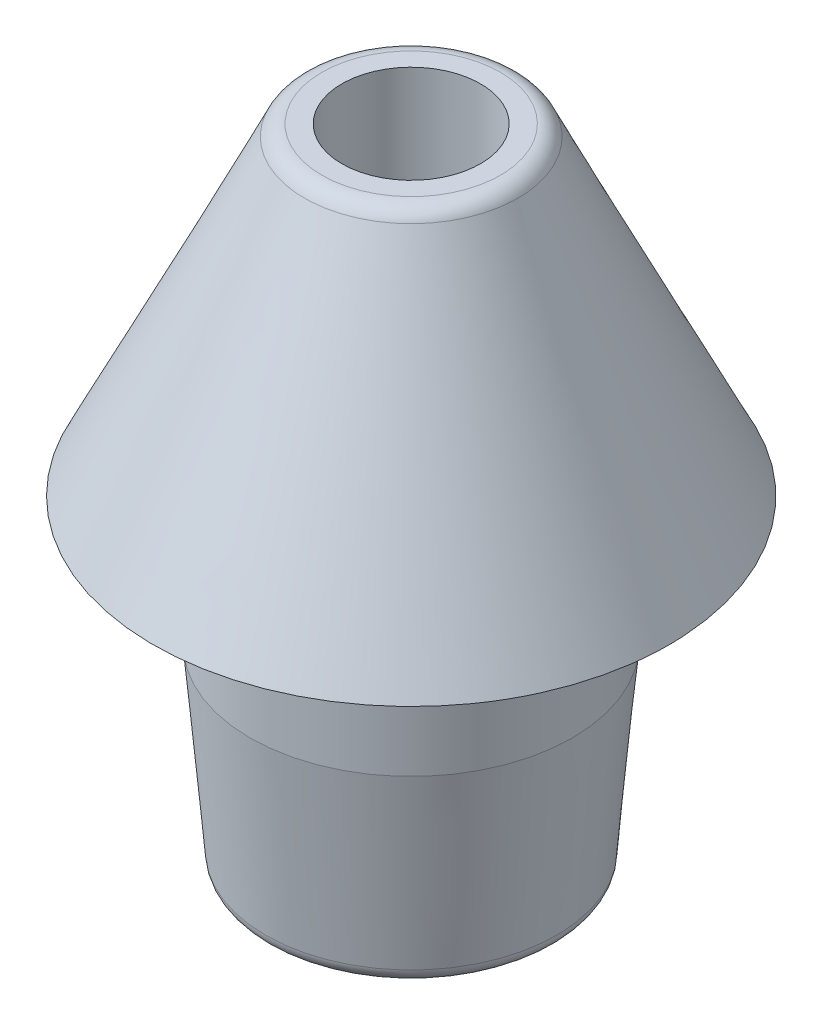
from build123d import *

# Parameters (mm, degrees)
SKETCH1_R           = 2.5
BOSS_EXTRUDE1_DEPTH = 5
SKETCH4_R           = 1.075
CUT_EXTRUDE1_DEPTH  = 12.489125363
CHAMFER1_SIZE       = 0.3
CHAMFER1_SIZE2      = 5.724341006
CHAMFER2_SIZE       = 3
CHAMFER2_SIZE2      = 0.262465991
FILLET1_R           = 0.3
FILLET2_R           = 0.25
FILLET4_R           = 0.25


with BuildPart() as part:
    # Sketch1 → Boss-Extrude1 (new body)
    with BuildSketch(Plane(origin=(0, 0, 0), x_dir=(1, 0, 0), z_dir=(0, 1, 0))):
        with Locations(Location((0, 0, 0), (0, 0, 270))):
            Circle(SKETCH1_R)
    extrude(amount=BOSS_EXTRUDE1_DEPTH)

    # Loft1: read off the stored shape, not the designer's step
    # Loft1: loft between two sections, ruled curve by curve
    loft1_from = [
        Edge.make_bspline([(-1.392393657, 10, -0.736114736), (0.079835815, 10, -3.52090205), (2.864623129, 10, -2.048672577), (1.392393657, 10, 0.736114736), (-0.079835815, 10, 3.52090205), (-2.864623129, 10, 2.048672577), (-1.392393657, 10, -0.736114736)], [0, 0, 0, 0, 0.5, 0.5, 0.5, 1, 1, 1, 1], 3, [1, 0.333333333, 0.333333333, 1, 0.333333333, 0.333333333, 1]),
    ]
    loft1_to = [
        Edge.make_bspline([(-3.843967333, 5, -1.106306985), (-1.631353363, 5, -8.79424165), (6.056581302, 5, -6.581627681), (3.843967333, 5, 1.106306985), (1.631353363, 5, 8.79424165), (-6.056581302, 5, 6.581627681), (-3.843967333, 5, -1.106306985)], [0, 0, 0, 0, 0.5, 0.5, 0.5, 1, 1, 1, 1], 3, [1, 0.333333333, 0.333333333, 1, 0.333333333, 0.333333333, 1]),
    ]
    loft1 = Solid(Shell([*[Face.make_surface_from_curves(loft1_from[k], loft1_to[k]) for k in range(1)], Face(Wire(loft1_from)), Face(Wire(loft1_to))]))
    add(loft1)

    # Sketch4 → Cut-Extrude1 (cut, through all)
    with BuildSketch(Plane(origin=(0, 10, 0), x_dir=(1, 0, 0), z_dir=(0, 1, 0))):
        with Locations(Location((0, 0, 0), (0, 0, 270))):
            Circle(SKETCH4_R)
    extrude(amount=-CUT_EXTRUDE1_DEPTH, mode=Mode.SUBTRACT)

    # Chamfer1
    chamfer1_edges = [part.edges().sort_by_distance(p)[0] for p in [
        (0, 0, -1.075),
    ]]
    chamfer1_side = [part.faces().sort_by_distance(p)[0] for p in [
        (0, 0, -2.429289322),
    ]]
    chamfer(chamfer1_edges, length=CHAMFER1_SIZE, length2=CHAMFER1_SIZE2, reference=chamfer1_side[0])

    # Chamfer2
    chamfer2_edges = [part.edges().sort_by_distance(p)[0] for p in [
        (0, 0, -2.5),
    ]]
    chamfer2_side = [part.faces().sort_by_distance(p)[0] for p in [
        (0, 2.5, -2.5),
    ]]
    chamfer(chamfer2_edges, length=CHAMFER2_SIZE, length2=CHAMFER2_SIZE2, reference=chamfer2_side[0])

    # Fillet1
    fillet1_edges = [part.edges().sort_by_distance(p)[0] for p in [
        (1.392393657, 10, 0.736114736),
    ]]
    fillet(fillet1_edges, radius=FILLET1_R)

    # Fillet2
    fillet2_edges = [part.edges().sort_by_distance(p)[0] for p in [
        (0, 5, -2.5),
    ]]
    fillet(fillet2_edges, radius=FILLET2_R)

    # Fillet4
    fillet4_edges = [part.edges().sort_by_distance(p)[0] for p in [
        (0, 0, -1.375),
        (0, 0, -2.237534009),
    ]]
    fillet(fillet4_edges, radius=FILLET4_R)


solid = part.part
